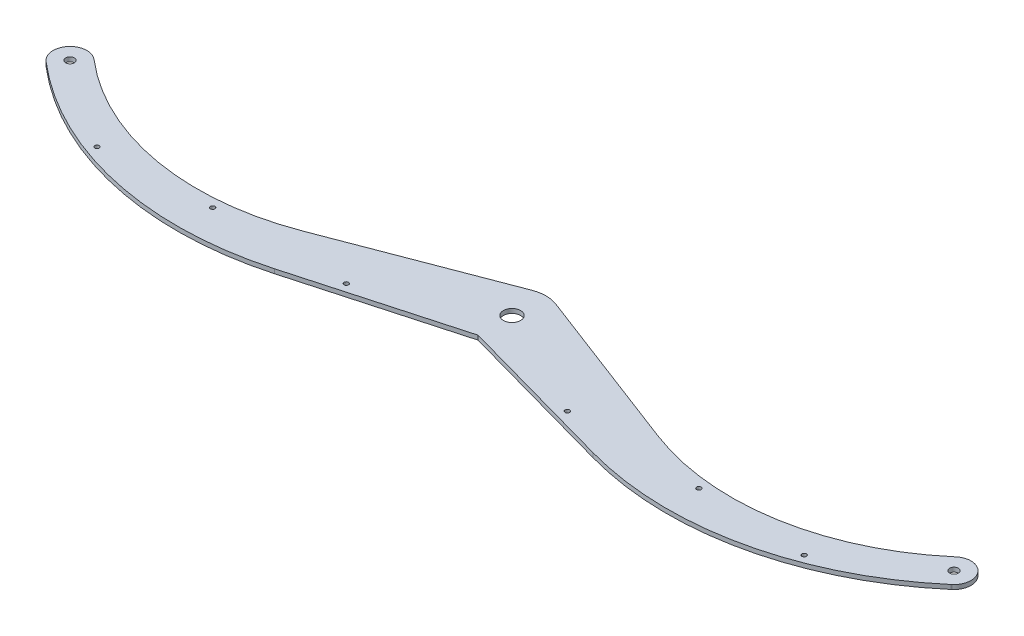
from build123d import *

# Parameters (mm, degrees)
BOSS_EXTRUDE1_DEPTH = 3.18
SKETCH3_R           = 3.175
SKETCH3_R_2         = 6.35
SKETCH3_R_3         = 1.65
CUT_EXTRUDE1_DEPTH  = 344.936785066


with BuildPart() as part:
    # Sketch1 → Boss-Extrude1 (new body)
    with BuildSketch(Plane(origin=(0, 0, 0), x_dir=(1, 0, 0), z_dir=(0, 1, 0))):
        with BuildLine():
            Line((-316.883271773, 9.506246519), (-316.457354569, 9.142585196))
            ThreePointArc((-316.457354569, 9.142585196), (-227.815789201, -32.465901654), (-130.352994696, -23.000333716))
            Line((-130.352994696, -23.000333716), (-8.915781366, 23.356130729))
            ThreePointArc((-8.915781366, 23.356130729), (0, 25), (8.915781366, 23.356130729))
            Line((8.915781366, 23.356130729), (130.352994696, -23.000333716))
            ThreePointArc((130.352994696, -23.000333716), (227.815789201, -32.465901654), (316.457354569, 9.142585196))
            Line((316.457354569, 9.142585196), (316.883271773, 9.506246519))
            ThreePointArc((316.883271773, 9.506246519), (334.506246519, 8.116728227), (333.116728227, -9.506246519))
            Line((333.116728227, -9.506246519), (332.690811024, -9.869907842))
            ThreePointArc((332.690811024, -9.869907842), (230.873321689, -60.601151934), (117.157638275, -57.567407196))
            Line((117.157638275, -57.567407196), (0, -25))
            Line((0, -25), (-117.157638275, -57.567407196))
            ThreePointArc((-117.157638275, -57.567407196), (-230.873321689, -60.601151934), (-332.690811024, -9.869907842))
            Line((-332.690811024, -9.869907842), (-333.116728227, -9.506246519))
            ThreePointArc((-333.116728227, -9.506246519), (-334.506246519, 8.116728227), (-316.883271773, 9.506246519))
        make_face()
    extrude(amount=BOSS_EXTRUDE1_DEPTH)

    # Sketch3 → Cut-Extrude1 (cut, through all)
    with BuildSketch(Plane(origin=(0, 3.18, 0), x_dir=(1, 0, 0), z_dir=(0, 1, 0))):
        with Locations((-325, 0)):
            Circle(SKETCH3_R)
        Circle(SKETCH3_R_2)
        with Locations((-260, -45.151120288)):
            Circle(SKETCH3_R_3)
        with Locations((-178.75, -41.327805807)):
            Circle(SKETCH3_R_3)
        with Locations((-81.25, -40.58582431)):
            Circle(SKETCH3_R_3)
        with Locations((81.25, -40.58582431)):
            Circle(SKETCH3_R_3)
        with Locations((178.75, -41.327805807)):
            Circle(SKETCH3_R_3)
        with Locations((260, -45.151120288)):
            Circle(SKETCH3_R_3)
        with Locations((325, 0)):
            Circle(SKETCH3_R)
    extrude(amount=-CUT_EXTRUDE1_DEPTH, mode=Mode.SUBTRACT)


solid = part.part
